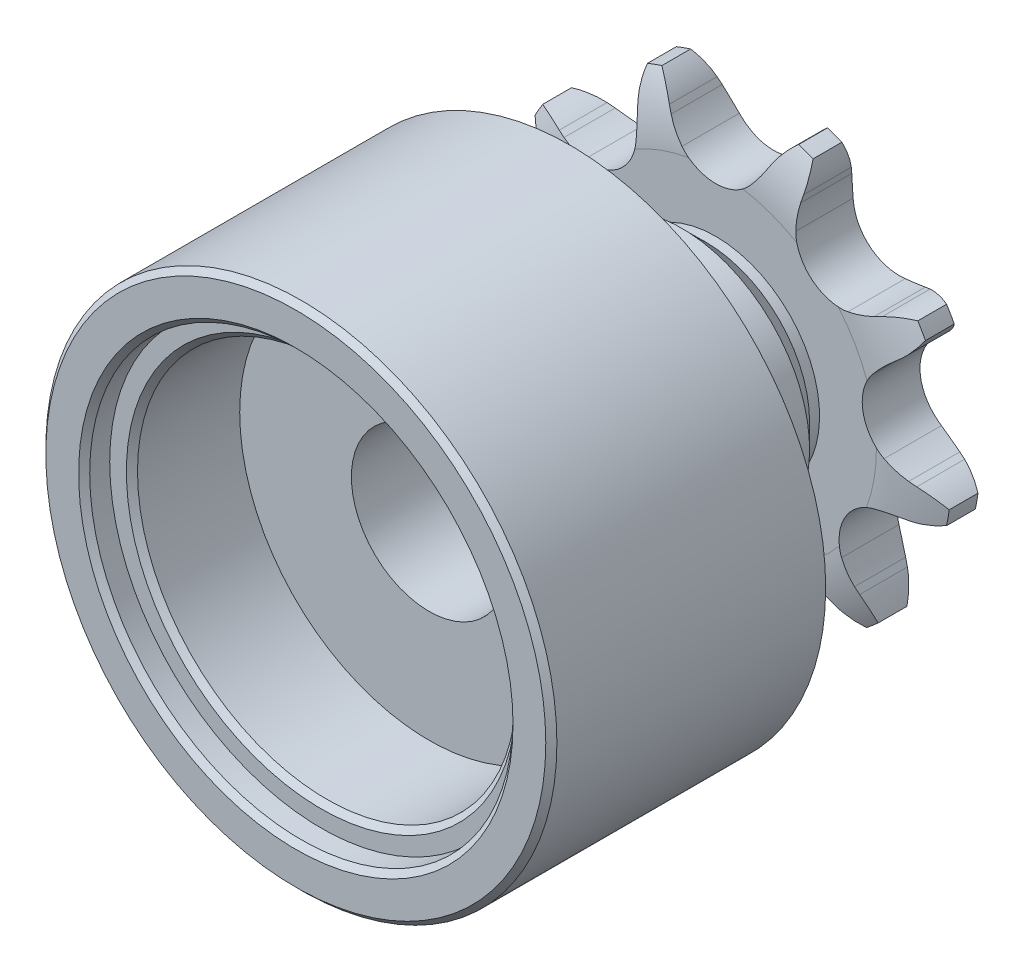
from build123d import *

# Parameters (mm, degrees)
CUT_EXTRUDE1_DEPTH      = 15.261517848
CIRPATTERN1_COUNT       = 9
BOSS_EXTRUDE1_START     = 1.3
SKETCH2_R               = 5.75
BOSS_EXTRUDE1_DEPTH     = 7.4
CUT_EXTRUDE2_DEPTH      = 17.591034702
CUT_EXTRUDE2_DEPTH_BACK = 17.591034702
SKETCH3_R               = 2.5
SKETCH4_W               = 1.95
SKETCH4_H               = 5.371019058
CUT_EXTRUDE3_DEPTH      = 17.591034702
CUT_EXTRUDE3_DEPTH_BACK = 17.591034702
SKETCH5_OUTSIDE_W       = 27.798
SKETCH5_OUTSIDE_H       = 27.5
SKETCH5_OUTSIDE_R       = 9.95
SKETCH6_R               = 11.5
BOSS_EXTRUDE2_DEPTH     = 12
CUT_EXTRUDE4_DEPTH      = 26.933376178
CUT_EXTRUDE4_DEPTH_BACK = 26.933376178
SKETCH7_R               = 3.5
SKETCH8_R               = 8.525
CUT_EXTRUDE5_DEPTH      = 6
SKETCH9_R               = 9.525
CUT_EXTRUDE6_DEPTH      = 1.15
CHAMFER1_SIZE           = 1.5
CHAMFER2_SIZE           = 6.5
CHAMFER2_SIZE_2         = 3
CHAMFER3_SIZE           = 0.25


with BuildPart() as part:
    # Sketch1 → Revolve1 (revolve)
    with BuildSketch(Plane(origin=(0, 0, 0), x_dir=(0, 0, -1), z_dir=(1, 0, 0))):
        with BuildLine():
            Line((1.3, 0), (-1.3, 0))
            Line((-1.3, 0), (-1.3, 7.229960036))
            ThreePointArc((-1.3, 7.229960036), (-1.122370651, 8.679097711), (-0.6, 10.042432258))
            Line((-0.6, 10.042432258), (0.6, 10.042432258))
            ThreePointArc((0.6, 10.042432258), (1.122370651, 8.679097711), (1.3, 7.229960036))
            Line((1.3, 7.229960036), (1.3, 0))
        make_face()
    revolve(axis=Axis((0, 0, -1.3), (0, 0, 1)))

    # Sketch0 → Cut-Extrude1 (cut, symmetric)
    with BuildSketch(Plane.XY):
        with BuildLine():
            Line((5.098468609, -7.244145344), (4.862482466, -7.045348332))
            ThreePointArc((4.862482466, -7.045348332), (4.432831877, -6.719619585), (3.972029017, -6.439691789))
            ThreePointArc((3.972029017, -6.439691789), (2.299508544, -6.317847802), (1.096603336, -7.486261148))
            ThreePointArc((1.096603336, -7.486261148), (0.923541984, -7.996896649), (0.803784941, -8.522593421))
            Line((0.803784941, -8.522593421), (0.750793323, -8.826569736))
            ThreePointArc((0.750793323, -8.826569736), (-0.832851059, -11.14866988), (-3.623218265, -11.486204271))
            ThreePointArc((-3.623218265, -11.486204271), (4.11932842, -11.317761816), (10.158736006, -6.469983147))
            ThreePointArc((10.158736006, -6.469983147), (7.804227789, -8.005030268), (5.098468609, -7.244145344))
        make_face()
    cut_extrude1 = extrude(amount=CUT_EXTRUDE1_DEPTH, both=True, mode=Mode.SUBTRACT)

    # CirPattern1: Cut-Extrude1 ×9 about axis
    cirpattern1_axis = Axis((0, 0, 0), (0, 0, 1))
    for i in range(1, CIRPATTERN1_COUNT):
        add(cut_extrude1.rotate(cirpattern1_axis, i * 360 / CIRPATTERN1_COUNT), mode=Mode.SUBTRACT)

    # Sketch2 → Boss-Extrude1 (add)
    with BuildSketch(Plane.XY.offset(BOSS_EXTRUDE1_START)):
        with Locations(Location((0, 0, 0), (0, 0, 270))):
            Circle(SKETCH2_R)
    extrude(amount=BOSS_EXTRUDE1_DEPTH)

    # Sketch3 → Cut-Extrude2 (cut, two sides: drawn at the far end of the back side and taken through both)
    with BuildSketch(Plane.XY.offset(-CUT_EXTRUDE2_DEPTH_BACK)):
        Circle(SKETCH3_R)
    extrude(amount=CUT_EXTRUDE2_DEPTH + CUT_EXTRUDE2_DEPTH_BACK, mode=Mode.SUBTRACT)

    # Sketch4 → Cut-Revolve1 (revolve, cut)
    with BuildSketch(Plane(origin=(0, 0, 0), x_dir=(0, 0, -1), z_dir=(1, 0, 0))):
        Polygon((-8.7, 5.75), (-8.7, 5.25), (-8.2, 5.75), align=None)
        with Locations((-2.275, 7.356922729)):
            Rectangle(SKETCH4_W, SKETCH4_H)
    revolve(axis=Axis((0, 0, -1.3), (0, 0, 1)), mode=Mode.SUBTRACT)

    # Sketch5 outside → Cut-Extrude3 (cut, two sides: drawn at the far end of the back side and taken through both)
    with BuildSketch(Plane.XY.offset(-CUT_EXTRUDE3_DEPTH_BACK)):
        with Locations((0, -0.255)):
            Rectangle(SKETCH5_OUTSIDE_W, SKETCH5_OUTSIDE_H)
        Circle(SKETCH5_OUTSIDE_R, mode=Mode.SUBTRACT)
    extrude(amount=CUT_EXTRUDE3_DEPTH + CUT_EXTRUDE3_DEPTH_BACK, mode=Mode.SUBTRACT)

    # Sketch6 → Boss-Extrude2 (add)
    with BuildSketch(Plane.XY.offset(8.2)):
        Circle(SKETCH6_R)
    extrude(amount=BOSS_EXTRUDE2_DEPTH)

    # Sketch7 → Cut-Extrude4 (cut, two sides: drawn at the far end of the back side and taken through both)
    with BuildSketch(Plane.XY.offset(-CUT_EXTRUDE4_DEPTH_BACK)):
        Circle(SKETCH7_R)
    extrude(amount=CUT_EXTRUDE4_DEPTH + CUT_EXTRUDE4_DEPTH_BACK, mode=Mode.SUBTRACT)

    # Sketch8 → Cut-Extrude5 (cut)
    with BuildSketch(Plane.XY.offset(20.2)):
        Circle(SKETCH8_R)
    extrude(amount=-CUT_EXTRUDE5_DEPTH, mode=Mode.SUBTRACT)

    # Sketch9 → Cut-Extrude6 (cut)
    with BuildSketch(Plane.XY.offset(20.2)):
        Circle(SKETCH9_R)
    extrude(amount=-CUT_EXTRUDE6_DEPTH, mode=Mode.SUBTRACT)

    # Chamfer1
    # the kernel refuses this chamfer: 1.5 mm, written as the material it adds along each edge
    with BuildSketch(Plane(origin=(0, 0, 3.25), x_dir=(0, 1, 0), z_dir=(1, 0, 0))) as chamfer1_piece_1_section:
        Polygon((4.6714132, -CHAMFER1_SIZE), (4.6714132 + CHAMFER1_SIZE, 0), (4.6714132, 0), align=None)
    chamfer1_piece_1 = revolve(axis=Axis((0, 0, 3.25), (0, 0, 1)), mode=Mode.PRIVATE)
    chamfer1_piece_1 = chamfer1_piece_1 & Plane(origin=(0, 0, 2.291419024), x_dir=(0, -1, 0), z_dir=(0, 0, -1)) * Cylinder(5.75, 25, mode=Mode.PRIVATE)
    add(chamfer1_piece_1)

    # Chamfer2
    # the kernel refuses this chamfer: 6.5, 3 mm, written as the material it adds along each edge
    with BuildSketch(Plane(origin=(0, 0, 8.2), x_dir=(0, -1, 0), z_dir=(1, 0, 0))) as chamfer2_piece_1_section:
        Polygon((5.75 + CHAMFER2_SIZE, 0), (5.75, CHAMFER2_SIZE_2), (5.75, 0), align=None)
    chamfer2_piece_1 = revolve(axis=Axis((0, 0, 8.2), (0, 0, -1)), mode=Mode.PRIVATE)
    chamfer2_piece_1 = chamfer2_piece_1 & Plane(origin=(0, 0, 6.54627175), x_dir=(1, 0, 0), z_dir=(0, 0, -1)) * Cylinder(11.5, 49, mode=Mode.PRIVATE)
    add(chamfer2_piece_1)

    # Chamfer3
    chamfer3_edges = [part.edges().sort_by_distance(p)[0] for p in [
        (-11.5, 0, 20.2),
        (-9.525, 0, 20.2),
        (-8.525, 0, 19.05),
    ]]
    chamfer(chamfer3_edges, length=CHAMFER3_SIZE)


solid = part.part
